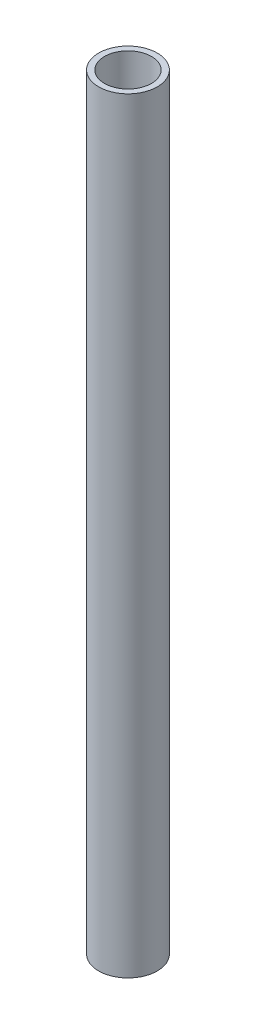
from build123d import *

# Parameters (mm, degrees)
SKETCH1_R           = 17.5
SKETCH1_R_2         = 14
BOSS_EXTRUDE1_DEPTH = 228.6


with BuildPart() as part:
    # Sketch1 → Boss-Extrude1 (new, symmetric)
    with BuildSketch(Plane(origin=(0, 0, 0), x_dir=(1, 0, 0), z_dir=(0, 1, 0))):
        Circle(SKETCH1_R)
        Circle(SKETCH1_R_2, mode=Mode.SUBTRACT)
    extrude(amount=BOSS_EXTRUDE1_DEPTH, both=True)


solid = part.part
